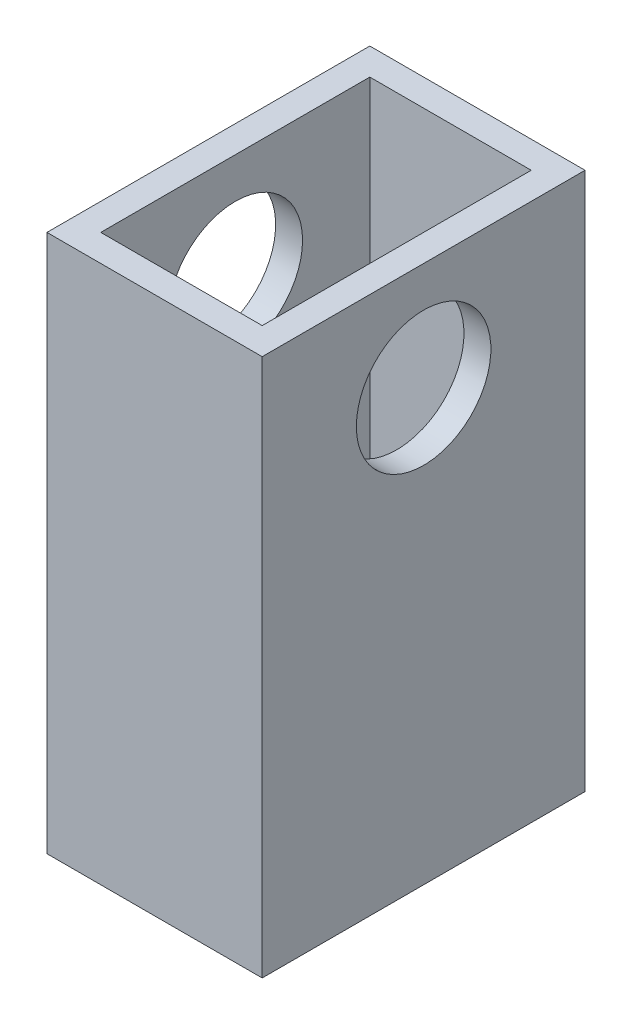
from build123d import *

# Parameters (mm, degrees)
SKETCH2_W           = 40
SKETCH2_H           = 60
BOSS_EXTRUDE1_DEPTH = 100
SHELL1_T            = -5
SKETCH3_R           = 12.5
CUT_EXTRUDE1_DEPTH  = 100


with BuildPart() as part:
    # Sketch2 → Boss-Extrude1 (new body)
    with BuildSketch(Plane(origin=(0, 0, 0), x_dir=(1, 0, 0), z_dir=(0, 1, 0))):
        with Locations((-20, -30)):
            Rectangle(SKETCH2_W, SKETCH2_H)
    extrude(amount=BOSS_EXTRUDE1_DEPTH)

    # Shell1
    shell1_openings = [part.faces().sort_by_distance(p)[0] for p in [
        (-20, 0, 30),
        (-20, 100, 30),
    ]]
    offset(amount=SHELL1_T, openings=shell1_openings, kind=Kind.INTERSECTION)

    # Sketch3 → Cut-Extrude1 (cut)
    with BuildSketch(Plane.ZY.offset(40)):
        with Locations((30, 80)):
            Circle(SKETCH3_R)
    extrude(amount=-CUT_EXTRUDE1_DEPTH, mode=Mode.SUBTRACT)


solid = part.part
